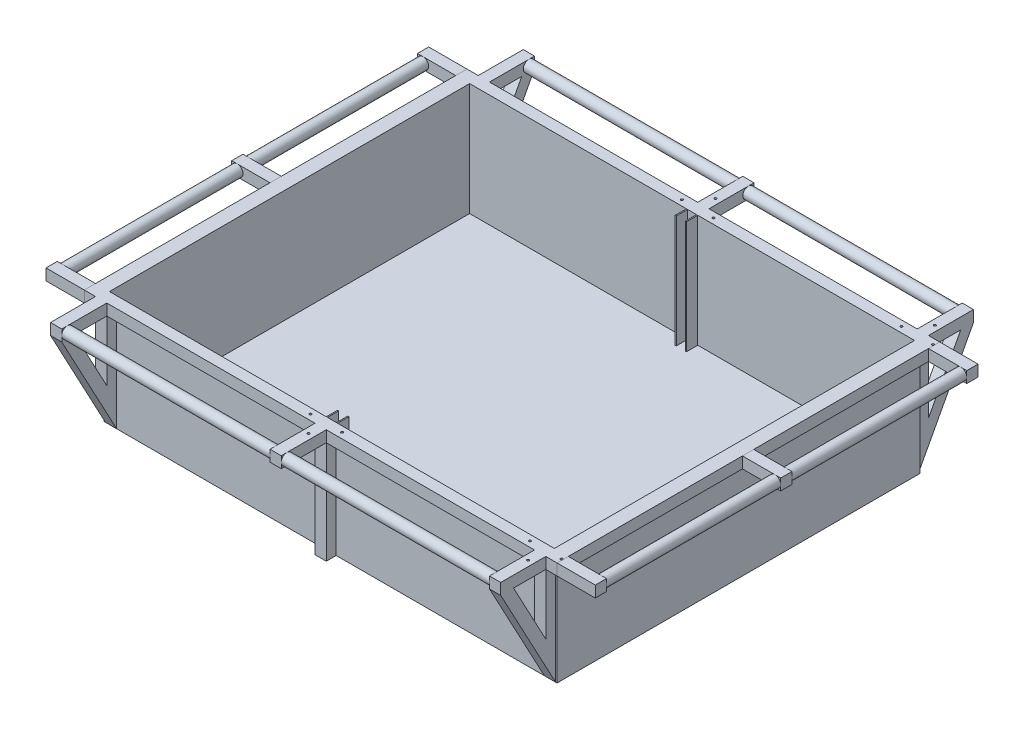
from build123d import *

# Parameters (mm, degrees)
SKETCH1_W            = 1050
SKETCH1_H            = 850
BOSS_EXTRUDE2_DEPTH  = 3
SKETCH2_W            = 1050
SKETCH2_H            = 850
SKETCH2_W_2          = 988.235294118
SKETCH2_H_2          = 800
BOSS_EXTRUDE4_DEPTH  = 250
SKETCH3_W            = 1050
SKETCH3_H            = 850
SKETCH3_W_2          = 1006
SKETCH3_H_2          = 806
CUT_EXTRUDE2_DEPTH   = 228
SKETCH6_W            = 25
SKETCH6_H            = 25
BASE_FLANGE1_DEPTH   = 85
SKETCH11_W           = 25
SKETCH11_H           = 25
BASE_FLANGE2_DEPTH   = 85
SKETCH14_W           = 25
SKETCH14_H           = 25
BASE_FLANGE3_DEPTH   = 85
SKETCH17_R           = 12.5
BASE_FLANGE5_DEPTH   = 800
SKETCH22_W           = 25
SKETCH22_H           = 25
BASE_FLANGE6_DEPTH   = 85
SKETCH25_W           = 25
SKETCH25_H           = 25
BASE_FLANGE7_DEPTH   = 85
SKETCH29_W           = 25
SKETCH29_H           = 25
BASE_FLANGE8_DEPTH   = 85
SKETCH32_R           = 12.5
BASE_FLANGE9_DEPTH   = 800
SKETCH83_W           = 25
SKETCH83_H           = 228
BOSS_EXTRUDE5_DEPTH  = 22
SKETCH85_W           = 25
SKETCH85_H           = 228
BOSS_EXTRUDE6_DEPTH  = 22
SKETCH87_W           = 25
SKETCH87_H           = 228
BOSS_EXTRUDE7_DEPTH  = 22
SKETCH88_W           = 25
SKETCH88_H           = 228
BOSS_EXTRUDE8_DEPTH  = 22
SKETCH89_W           = 25
SKETCH89_H           = 228
BOSS_EXTRUDE9_DEPTH  = 22
SKETCH90_W           = 25
SKETCH90_H           = 228
BOSS_EXTRUDE10_DEPTH = 22
SKETCH91_W           = 25
SKETCH91_H           = 25
BOSS_EXTRUDE11_DEPTH = 100
SKETCH92_W           = 25
SKETCH92_H           = 25
BOSS_EXTRUDE12_DEPTH = 100
SKETCH93_W           = 25
SKETCH93_H           = 25
BOSS_EXTRUDE13_DEPTH = 100
SKETCH94_W           = 25
SKETCH94_H           = 25
BOSS_EXTRUDE14_DEPTH = 100
SKETCH95_W           = 25
SKETCH95_H           = 25
BOSS_EXTRUDE15_DEPTH = 100
SKETCH96_W           = 25
SKETCH96_H           = 25
BOSS_EXTRUDE16_DEPTH = 100
SKETCH114_W          = 2.5
SKETCH114_H          = 250
BOSS_EXTRUDE22_DEPTH = 25
SKETCH120_W          = 2.5
SKETCH120_H          = 250
BOSS_EXTRUDE24_DEPTH = 25
RIB107_REACH         = 1255.688
SKETCH109_WALL_W     = 2767.964794142
SKETCH109_WALL_H     = 25
CUT_EXTRUDE10_DEPTH  = 30
RIB108_REACH         = 1255.688
SKETCH123_WALL_W     = 2767.964794142
SKETCH123_WALL_H     = 25
CUT_EXTRUDE12_DEPTH  = 30
CUT_EXTRUDE13_DEPTH  = 30
CUT_EXTRUDE14_DEPTH  = 30
RIB110_REACH         = 1255.688
SKETCH128_WALL_W     = 2767.964794142
SKETCH128_WALL_H     = 25
CUT_EXTRUDE15_DEPTH  = 30
CUT_EXTRUDE16_DEPTH  = 30
RIB118_REACH         = 1255.688
SKETCH134_WALL_W     = 2767.964794142
SKETCH134_WALL_H     = 25
CUT_EXTRUDE17_DEPTH  = 30
CUT_EXTRUDE18_DEPTH  = 30
SKETCH137_R          = 12.5
BOSS_EXTRUDE25_DEPTH = 950
SKETCH138_R          = 12.5
BOSS_EXTRUDE26_DEPTH = 950
SKETCH139_R          = 2.5
CUT_EXTRUDE30_DEPTH  = 30


# Sheet-metal steps are written as plain solids
with BuildPart() as part:
    # Sketch1 → Boss-Extrude2 (new body)
    with BuildSketch(Plane(origin=(0, 0, 0), x_dir=(1, 0, 0), z_dir=(0, 1, 0))):
        Rectangle(SKETCH1_W, SKETCH1_H)
    extrude(amount=BOSS_EXTRUDE2_DEPTH)

    # Sketch2 → Boss-Extrude4 (add)
    with BuildSketch(Plane(origin=(0, 3, 0), x_dir=(1, 0, 0), z_dir=(0, 1, 0))):
        Rectangle(SKETCH2_W, SKETCH2_H)
        Rectangle(SKETCH2_W_2, SKETCH2_H_2, mode=Mode.SUBTRACT)
    extrude(amount=BOSS_EXTRUDE4_DEPTH)

    # Sketch3 → Cut-Extrude2 (cut)
    with BuildSketch(Plane.XZ):
        Rectangle(SKETCH3_W, SKETCH3_H)
        Rectangle(SKETCH3_W_2, SKETCH3_H_2, mode=Mode.SUBTRACT)
    extrude(amount=-CUT_EXTRUDE2_DEPTH, mode=Mode.SUBTRACT)

    # Sketch83 → Boss-Extrude5 (add)
    with BuildSketch(Plane(origin=(0, 0, -403), x_dir=(-1, 0, 0), z_dir=(0, 0, -1))):
        with Locations((-487.5, 114)):
            Rectangle(SKETCH83_W, SKETCH83_H)
    extrude(amount=BOSS_EXTRUDE5_DEPTH)

    # Sketch85 → Boss-Extrude6 (add)
    with BuildSketch(Plane(origin=(0, 0, -403), x_dir=(-1, 0, 0), z_dir=(0, 0, -1))):
        with Locations((487.5, 114)):
            Rectangle(SKETCH85_W, SKETCH85_H)
    extrude(amount=BOSS_EXTRUDE6_DEPTH)

    # Sketch87 → Boss-Extrude7 (add)
    with BuildSketch(Plane(origin=(0, 0, -403), x_dir=(-1, 0, 0), z_dir=(0, 0, -1))):
        with Locations((0, 114)):
            Rectangle(SKETCH87_W, SKETCH87_H)
    extrude(amount=BOSS_EXTRUDE7_DEPTH)

    # Sketch88 → Boss-Extrude8 (add)
    with BuildSketch(Plane.XY.offset(403)):
        with Locations((-487.5, 114)):
            Rectangle(SKETCH88_W, SKETCH88_H)
    extrude(amount=BOSS_EXTRUDE8_DEPTH)

    # Sketch89 → Boss-Extrude9 (add)
    with BuildSketch(Plane.XY.offset(403)):
        with Locations((487.5, 114)):
            Rectangle(SKETCH89_W, SKETCH89_H)
    extrude(amount=BOSS_EXTRUDE9_DEPTH)

    # Sketch90 → Boss-Extrude10 (add)
    with BuildSketch(Plane.XY.offset(403)):
        with Locations((0, 114)):
            Rectangle(SKETCH90_W, SKETCH90_H)
    extrude(amount=BOSS_EXTRUDE10_DEPTH)

    # Sketch91 → Boss-Extrude11 (add)
    with BuildSketch(Plane.XY.offset(425)):
        with Locations((-487.5, 240.5)):
            Rectangle(SKETCH91_W, SKETCH91_H)
    extrude(amount=BOSS_EXTRUDE11_DEPTH)

    # Sketch92 → Boss-Extrude12 (add)
    with BuildSketch(Plane.XY.offset(425)):
        with Locations((0, 240.5)):
            Rectangle(SKETCH92_W, SKETCH92_H)
    extrude(amount=BOSS_EXTRUDE12_DEPTH)

    # Sketch93 → Boss-Extrude13 (add)
    with BuildSketch(Plane.XY.offset(425)):
        with Locations((487.5, 240.5)):
            Rectangle(SKETCH93_W, SKETCH93_H)
    extrude(amount=BOSS_EXTRUDE13_DEPTH)

    # Sketch94 → Boss-Extrude14 (add)
    with BuildSketch(Plane(origin=(0, 0, -425), x_dir=(-1, 0, 0), z_dir=(0, 0, -1))):
        with Locations((-487.5, 240.5)):
            Rectangle(SKETCH94_W, SKETCH94_H)
    extrude(amount=BOSS_EXTRUDE14_DEPTH)

    # Sketch95 → Boss-Extrude15 (add)
    with BuildSketch(Plane(origin=(0, 0, -425), x_dir=(-1, 0, 0), z_dir=(0, 0, -1))):
        with Locations((0, 240.5)):
            Rectangle(SKETCH95_W, SKETCH95_H)
    extrude(amount=BOSS_EXTRUDE15_DEPTH)

    # Sketch96 → Boss-Extrude16 (add)
    with BuildSketch(Plane(origin=(0, 0, -425), x_dir=(-1, 0, 0), z_dir=(0, 0, -1))):
        with Locations((487.5, 240.5)):
            Rectangle(SKETCH96_W, SKETCH96_H)
    extrude(amount=BOSS_EXTRUDE16_DEPTH)

    # Sketch114 → Boss-Extrude22 (add)
    with BuildSketch(Plane(origin=(0, 0, 400), x_dir=(-1, 0, 0), z_dir=(0, 0, -1))):
        with Locations((-11.25, 128)):
            Rectangle(SKETCH114_W, SKETCH114_H)
        with Locations((11.25, 128)):
            Rectangle(SKETCH114_W, SKETCH114_H)
    extrude(amount=BOSS_EXTRUDE22_DEPTH)

    # Sketch120 → Boss-Extrude24 (add)
    with BuildSketch(Plane.XY.offset(-400)):
        with Locations((-11.25, 128)):
            Rectangle(SKETCH120_W, SKETCH120_H)
        with Locations((11.25, 128)):
            Rectangle(SKETCH120_W, SKETCH120_H)
    extrude(amount=BOSS_EXTRUDE24_DEPTH)

    # Sketch109 wall → Rib107 (add, up to next)
    with BuildSketch(Plane(origin=(500, 114, 464), x_dir=(0, -0.881709824778, -0.471792099223), z_dir=(0, 0.471792099223, -0.881709824778)), mode=Mode.PRIVATE) as rib107_sk1:
        with Locations((0, 12.5)):
            Rectangle(SKETCH109_WALL_W, SKETCH109_WALL_H)
    rib107_tool1 = extrude(rib107_sk1.sketch, amount=RIB107_REACH, mode=Mode.PRIVATE) - part.part
    add(rib107_tool1.solids().sort_by_distance((500, 114, 464))[0])

    # Sketch121 → Cut-Extrude10 (cut)
    with BuildSketch(Plane(origin=(500, 0, 0), x_dir=(0, 0, -1), z_dir=(1, 0, 0))):
        Polygon((-425, 41.114754098), (-403, 0), (-425, 0), align=None)
    extrude(amount=-CUT_EXTRUDE10_DEPTH, mode=Mode.SUBTRACT)

    # Sketch123 wall → Rib108 (add, up to next)
    with BuildSketch(Plane(origin=(-500, 114, 464), x_dir=(0, -0.881709824778, -0.471792099223), z_dir=(0, -0.471792099223, 0.881709824778)), mode=Mode.PRIVATE) as rib108_sk1:
        with Locations((0, 12.5)):
            Rectangle(SKETCH123_WALL_W, SKETCH123_WALL_H)
    rib108_tool1 = extrude(rib108_sk1.sketch, amount=-RIB108_REACH, mode=Mode.PRIVATE) - part.part
    add(rib108_tool1.solids().sort_by_distance((-500, 114, 464))[0])

    # Sketch125 → Cut-Extrude12 (cut)
    with BuildSketch(Plane.ZY.offset(500)):
        Polygon((425, 41.114754098), (403, 0), (425, 0), align=None)
    extrude(amount=-CUT_EXTRUDE12_DEPTH, mode=Mode.SUBTRACT)

    # Sketch126 → Cut-Extrude13 (cut)
    with BuildSketch(Plane.ZY.offset(500)):
        Polygon((425, 228), (425, 94.104195933), (496.646000422, 228), align=None)
    extrude(amount=-CUT_EXTRUDE13_DEPTH, mode=Mode.SUBTRACT)

    # Sketch127 → Cut-Extrude14 (cut)
    with BuildSketch(Plane(origin=(500, 0, 0), x_dir=(0, 0, -1), z_dir=(1, 0, 0))):
        Polygon((-425, 228), (-496.646000422, 228), (-425, 94.104195933), align=None)
    extrude(amount=-CUT_EXTRUDE14_DEPTH, mode=Mode.SUBTRACT)

    # Sketch128 wall → Rib110 (add, up to next)
    with BuildSketch(Plane(origin=(500, 114, -464), x_dir=(0, -0.881709824778, 0.471792099223), z_dir=(0, -0.471792099223, -0.881709824778)), mode=Mode.PRIVATE) as rib110_sk1:
        with Locations((0, 12.5)):
            Rectangle(SKETCH128_WALL_W, SKETCH128_WALL_H)
    rib110_tool1 = extrude(rib110_sk1.sketch, amount=-RIB110_REACH, mode=Mode.PRIVATE) - part.part
    add(rib110_tool1.solids().sort_by_distance((500, 114, -464))[0])

    # Sketch129 → Cut-Extrude15 (cut)
    with BuildSketch(Plane(origin=(500, 0, 0), x_dir=(0, 0, -1), z_dir=(1, 0, 0))):
        Polygon((425, 41.114754098), (403, 0), (425, 0), align=None)
    extrude(amount=-CUT_EXTRUDE15_DEPTH, mode=Mode.SUBTRACT)

    # Sketch130 → Cut-Extrude16 (cut)
    with BuildSketch(Plane(origin=(500, 0, 0), x_dir=(0, 0, -1), z_dir=(1, 0, 0))):
        Polygon((425, 228), (425, 94.104195933), (496.646000422, 228), align=None)
    extrude(amount=-CUT_EXTRUDE16_DEPTH, mode=Mode.SUBTRACT)

    # Sketch134 wall → Rib118 (add, up to next)
    with BuildSketch(Plane(origin=(-500, 114, -464), x_dir=(0, -0.881709824778, 0.471792099223), z_dir=(0, 0.471792099223, 0.881709824778)), mode=Mode.PRIVATE) as rib118_sk1:
        with Locations((0, 12.5)):
            Rectangle(SKETCH134_WALL_W, SKETCH134_WALL_H)
    rib118_tool1 = extrude(rib118_sk1.sketch, amount=RIB118_REACH, mode=Mode.PRIVATE) - part.part
    add(rib118_tool1.solids().sort_by_distance((-500, 114, -464))[0])

    # Sketch135 → Cut-Extrude17 (cut)
    with BuildSketch(Plane.ZY.offset(500)):
        Polygon((-425, 41.114754098), (-425, 0), (-403, 0), align=None)
    extrude(amount=-CUT_EXTRUDE17_DEPTH, mode=Mode.SUBTRACT)

    # Sketch136 → Cut-Extrude18 (cut)
    with BuildSketch(Plane.ZY.offset(500)):
        Polygon((-425, 228), (-496.646000422, 228), (-425, 94.104195933), align=None)
    extrude(amount=-CUT_EXTRUDE18_DEPTH, mode=Mode.SUBTRACT)

    # Sketch137 → Boss-Extrude25 (add)
    with BuildSketch(Plane.ZY.offset(-475)):
        with Locations(Location((-512.5, 240.5, 0), (0, 0, 180))):
            Circle(SKETCH137_R)
    extrude(amount=BOSS_EXTRUDE25_DEPTH)

    # Sketch138 → Boss-Extrude26 (add)
    with BuildSketch(Plane(origin=(-475, 0, 0), x_dir=(0, 0, -1), z_dir=(1, 0, 0))):
        with Locations(Location((-512.5, 240.5, 0), (0, 0, 180))):
            Circle(SKETCH138_R)
    extrude(amount=BOSS_EXTRUDE26_DEPTH)


with BuildPart() as body_2:
    # Sketch6 → Base-Flange1 (new body)
    with BuildSketch(Plane(origin=(525, 0, 0), x_dir=(0, 0, -1), z_dir=(1, 0, 0))):
        with Locations((-412.5, 240.5)):
            Rectangle(SKETCH6_W, SKETCH6_H)
    extrude(amount=BASE_FLANGE1_DEPTH)


with BuildPart() as body_3:
    # Sketch11 → Base-Flange2 (new body)
    with BuildSketch(Plane(origin=(525, 0, 0), x_dir=(0, 0, -1), z_dir=(1, 0, 0))):
        with Locations((412.5, 240.5)):
            Rectangle(SKETCH11_W, SKETCH11_H)
    extrude(amount=BASE_FLANGE2_DEPTH)


with BuildPart() as body_4:
    # Sketch14 → Base-Flange3 (new body)
    with BuildSketch(Plane(origin=(525, 0, 0), x_dir=(0, 0, -1), z_dir=(1, 0, 0))):
        with Locations((-0.707172723, 240.5)):
            Rectangle(SKETCH14_W, SKETCH14_H)
    extrude(amount=BASE_FLANGE3_DEPTH)


with BuildPart() as body_5:
    # Sketch17 → Base-Flange5 (new body)
    with BuildSketch(Plane(origin=(0, 0, 400), x_dir=(-1, 0, 0), z_dir=(0, 0, -1))):
        with Locations(Location((-597.5, 240.5, 0), (0, 0, 90))):
            Circle(SKETCH17_R)
    extrude(amount=BASE_FLANGE5_DEPTH)


with BuildPart() as body_6:
    # Sketch22 → Base-Flange6 (new body)
    with BuildSketch(Plane.ZY.offset(525)):
        with Locations((-412.5, 240.5)):
            Rectangle(SKETCH22_W, SKETCH22_H)
    extrude(amount=BASE_FLANGE6_DEPTH)


with BuildPart() as body_7:
    # Sketch25 → Base-Flange7 (new body)
    with BuildSketch(Plane.ZY.offset(525)):
        with Locations((412.5, 240.5)):
            Rectangle(SKETCH25_W, SKETCH25_H)
    extrude(amount=BASE_FLANGE7_DEPTH)


with BuildPart() as body_8:
    # Sketch29 → Base-Flange8 (new body)
    with BuildSketch(Plane.ZY.offset(525)):
        with Locations((0, 240.5)):
            Rectangle(SKETCH29_W, SKETCH29_H)
    extrude(amount=BASE_FLANGE8_DEPTH)


with BuildPart() as body_9:
    # Sketch32 → Base-Flange9 (new body)
    with BuildSketch(Plane.XY.offset(-400)):
        with Locations((-597.5, 240.5)):
            Circle(SKETCH32_R)
    extrude(amount=BASE_FLANGE9_DEPTH)


with BuildPart() as cut_extrude30_tool:
    # Sketch139 → Cut-Extrude30 (new body)
    with BuildSketch(Plane(origin=(0, 253, 0), x_dir=(1, 0, 0), z_dir=(0, 1, 0))):
        with Locations(Location((35, -412.5, 0), (0, 0, 270))):
            Circle(SKETCH139_R)
        with Locations(Location((-35, -412.5, 0), (0, 0, 90))):
            Circle(SKETCH139_R)
        with Locations(Location((0, -451.81, 0), (0, 0, 270))):
            Circle(SKETCH139_R)
        with Locations(Location((0, 451.81, 0), (0, 0, 270))):
            Circle(SKETCH139_R)
        with Locations(Location((35, 412.5, 0), (0, 0, 90))):
            Circle(SKETCH139_R)
        with Locations(Location((-35, 412.5, 0), (0, 0, 270))):
            Circle(SKETCH139_R)
        with Locations(Location((452.5, 412.5, 0), (0, 0, 270))):
            Circle(SKETCH139_R)
        with Locations((522.6, 412.5)):
            Circle(SKETCH139_R)
        with Locations(Location((487.5, 451.81, 0), (0, 0, 270))):
            Circle(SKETCH139_R)
        with Locations((522.6, -412.5)):
            Circle(SKETCH139_R)
        with Locations(Location((452.5, -412.5, 0), (0, 0, 90))):
            Circle(SKETCH139_R)
        with Locations(Location((487.5, -451.81, 0), (0, 0, 270))):
            Circle(SKETCH139_R)
    extrude(amount=-CUT_EXTRUDE30_DEPTH)


with BuildPart() as part_1:
    add(part.part)

    # Cut-Extrude30: cut by cut_extrude30_tool
    add(cut_extrude30_tool.part, mode=Mode.SUBTRACT)


with BuildPart() as body_2_1:
    add(body_2.part)

    # Cut-Extrude30: cut by cut_extrude30_tool
    add(cut_extrude30_tool.part, mode=Mode.SUBTRACT)


with BuildPart() as body_3_1:
    add(body_3.part)

    # Cut-Extrude30: cut by cut_extrude30_tool
    add(cut_extrude30_tool.part, mode=Mode.SUBTRACT)


solid = Compound([body_4.part, body_5.part, body_6.part, body_7.part, body_8.part, body_9.part, part_1.part, body_2_1.part, body_3_1.part])
